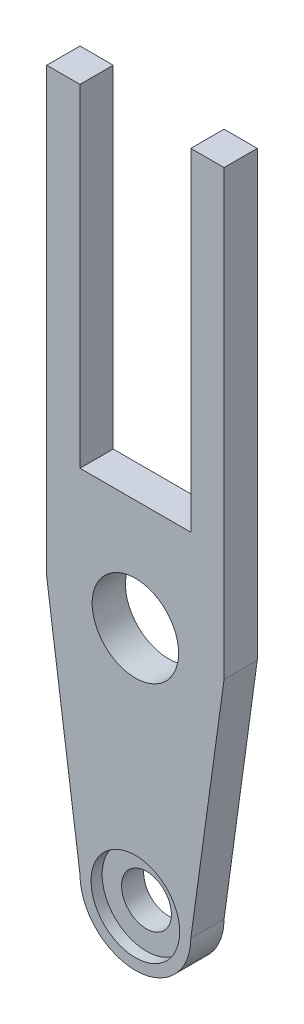
from build123d import *

# Parameters (mm, degrees)
SKETCH_4_R                   = 3.9
EXTRUDE_1_DEPTH              = 3
HOLE_WIZARD_M4_1_D           = 4.5
HOLE_WIZARD_M4_1_CBORE_D     = 8
HOLE_WIZARD_M4_1_CBORE_DEPTH = 1


with BuildPart() as part:
    # 草图4 → 凸台-拉伸1 (new body)
    with BuildSketch(Plane.XY):
        with BuildLine():
            Line((-5, 30), (-5, 10))
            Line((-5, 10), (5, 10))
            Line((5, 10), (5, 25))
            Line((5, 25), (5, 30))
            Line((5, 30), (5, 40))
            Line((5, 40), (8, 40))
            Line((8, 40), (8, 30))
            Line((8, 30), (8, 0))
            Line((8, 0), (5, -21.75))
            ThreePointArc((5, -21.75), (0, -26.75), (-5, -21.75))
            Line((-5, -21.75), (-8, 0))
            Line((-8, 0), (-8, 30))
            Line((-8, 30), (-8, 40))
            Line((-8, 40), (-5, 40))
            Line((-5, 40), (-5, 30))
        make_face()
        Circle(SKETCH_4_R, mode=Mode.SUBTRACT)
    extrude(amount=EXTRUDE_1_DEPTH)

    # M4 六角凹头盖的柱孔1 (through all)
    with Locations(Plane(origin=(0, -21.75, 3), x_dir=(1, 0, 0), z_dir=(0, 0, 1))):
        with Locations((0, 0)):
            CounterBoreHole(HOLE_WIZARD_M4_1_D / 2, HOLE_WIZARD_M4_1_CBORE_D / 2, HOLE_WIZARD_M4_1_CBORE_DEPTH)


solid = part.part
